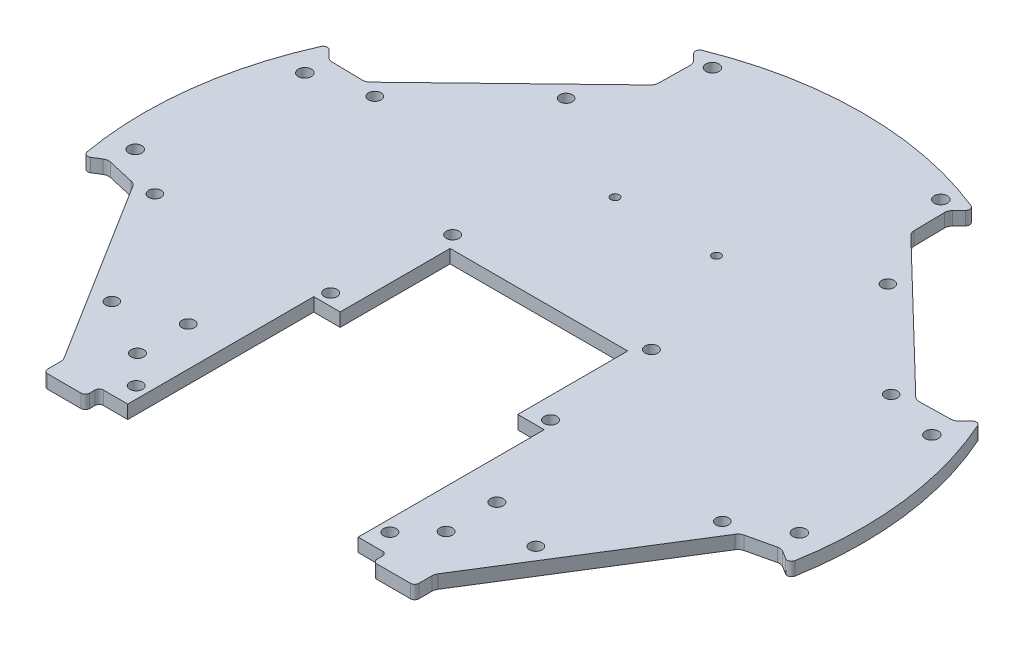
from build123d import *

# Parameters (mm, degrees)
BOSS_EXTRUDE4_DEPTH  = 1.5875
M3_CLEARANCE_HOLE3_D = 3
M3_CLEARANCE_HOLE1_D = 3.1
M3_CLEARANCE_HOLE4_D = 2.95
M3_CLEARANCE_HOLE2_D = 3.1
BOSS_EXTRUDE6_DEPTH  = 3.175
FILLET1_R            = 2
FILLET3_R            = 1
FILLET6_R            = 0.5
SKETCH28_W           = 54.5
SKETCH28_H           = 45
CUT_EXTRUDE4_DEPTH   = 10
CUT_EXTRUDE5_DEPTH   = 10
SKETCH30_W           = 42
SKETCH30_H           = 26
CUT_EXTRUDE6_DEPTH   = 10
SKETCH31_R           = 1.5
CUT_EXTRUDE7_DEPTH   = 10
SKETCH34_R           = 1
CUT_EXTRUDE9_DEPTH   = 10
SKETCH35_R           = 1.5
CUT_EXTRUDE10_DEPTH  = 121.250075508


with BuildPart() as part:
    # Sketch1 → Boss-Extrude4 (new, symmetric)
    with BuildSketch(Plane(origin=(0, 0, 0), x_dir=(1, 0, 0), z_dir=(0, 1, 0))):
        with BuildLine():
            Line((-62.799553621, 32.496136604), (-73.969425011, 32.691107434))
            Line((-73.969425011, 32.691107434), (-77.053684287, 35.88495141))
            ThreePointArc((-77.053684287, 35.88495141), (-84.36642289, 10.358894189), (-83.446216027, -16.178041625))
            Line((-83.446216027, -16.178041625), (-79.680911643, -13.825218315))
            Line((-79.680911643, -13.825218315), (-69.484649137, -16.179210996))
            Line((-69.484649137, -16.179210996), (-43.894490772, -57.132025032))
            Line((-43.894490772, -57.132025032), (-43.894490772, -64.826600275))
            Line((-43.894490772, -64.826600275), (-43.094490772, -64.826600275))
            Line((-43.094490772, -64.826600275), (-34, -64.826600275))
            Line((-34, -64.826600275), (-34, -62.55))
            Line((-34, -62.55), (-34, -61.55))
            Line((-34, -61.55), (-20, -61.55))
            Line((-20, -61.55), (-19.859459165, -62.55))
            Line((-19.859459165, -62.55), (19.859459165, -62.55))
            Line((19.859459165, -62.55), (20, -61.55))
            Line((20, -61.55), (34, -61.55))
            Line((34, -61.55), (34, -62.55))
            Line((34, -62.55), (34, -64.826600275))
            Line((34, -64.826600275), (43.094490772, -64.826600275))
            Line((43.094490772, -64.826600275), (43.894490772, -64.826600275))
            Line((43.894490772, -64.826600275), (43.894490772, -57.132025032))
            Line((43.894490772, -57.132025032), (69.484649137, -16.179210996))
            Line((69.484649137, -16.179210996), (79.680911643, -13.825218315))
            Line((79.680911643, -13.825218315), (83.446216027, -16.178041625))
            ThreePointArc((83.446216027, -16.178041625), (84.610662337, -8.126242604), (85, 0))
            ThreePointArc((85, 0), (82.98964744, 18.377116688), (77.053684287, 35.88495141))
            Line((77.053684287, 35.88495141), (73.969425011, 32.691107434))
            Line((73.969425011, 32.691107434), (62.799553621, 32.496136604))
            Line((62.799553621, 32.496136604), (30.284668021, 63.895396642))
            Line((30.284668021, 63.895396642), (30.089697191, 75.065268032))
            Line((30.089697191, 75.065268032), (33.173956467, 78.259112008))
            ThreePointArc((33.173956467, 78.259112008), (0, 85), (-33.173956467, 78.259112008))
            Line((-33.173956467, 78.259112008), (-30.089697191, 75.065268032))
            Line((-30.089697191, 75.065268032), (-30.284668021, 63.895396642))
            Line((-30.284668021, 63.895396642), (-62.799553621, 32.496136604))
        make_face()
    extrude(amount=BOSS_EXTRUDE4_DEPTH, both=True)

    # M3 Clearance Hole3 (through all)
    with Locations(Plane(origin=(0, -1.5875, 0), x_dir=(-1, 0, 0), z_dir=(0, -1, 0))):
        with Locations((36.5, -50), (36.5, -38), (-36.5, -50), (-36.5, -38)):
            Hole(M3_CLEARANCE_HOLE3_D / 2)

    # M3 Clearance Hole1 (through all)
    with Locations(Plane(origin=(0, 1.5875, 0), x_dir=(1, 0, 0), z_dir=(0, 1, 0))):
        with Locations((-78.542321426, -8.49139241), (78.542321426, -8.49139241), (74.155025063, 27.240269049), (-74.155025063, 27.240269049)):
            Hole(M3_CLEARANCE_HOLE1_D / 2)

    # M3 Clearance Hole4 (through all)
    with Locations(Plane(origin=(0, -1.5875, 0), x_dir=(-1, 0, 0), z_dir=(0, -1, 0))):
        with Locations((-67.099301622, -15.278865202), (-50.141885166, -42.416404279), (-61.062544382, 30.698137949), (-38.043670771, 52.927205804), (50.141885166, -42.416404279), (67.099301622, -15.278865202), (38.043670771, 52.927205804), (61.062544382, 30.698137949)):
            Hole(M3_CLEARANCE_HOLE4_D / 2)

    # M3 Clearance Hole2 (through all)
    with Locations(Plane(origin=(0, 1.5875, 0), x_dir=(1, 0, 0), z_dir=(0, 1, 0))):
        with Locations((27, 76.497766718), (-27, 76.497766718)):
            Hole(M3_CLEARANCE_HOLE2_D / 2)

    # Sketch22 → Boss-Extrude6 (add)
    with BuildSketch(Plane(origin=(0, 1.5875, 0), x_dir=(1, 0, 0), z_dir=(0, 1, 0))):
        Polygon((65.061950694, 32.535626892), (30.245177733, 66.157793715), (30.284668021, 63.895396642), (62.799553621, 32.496136604), align=None)
        Polygon((-30.284668021, 63.895396642), (-30.245177733, 66.157793715), (-65.061950694, 32.535626892), (-62.799553621, 32.496136604), align=None)
        Polygon((43.894490772, -60.151352895), (71.689396914, -15.670204865), (69.484649137, -16.179210996), (43.894490772, -57.132025032), align=None)
        Polygon((-69.484649137, -16.179210996), (-71.689396914, -15.670204865), (-43.894490772, -60.151352895), (-43.894490772, -57.132025032), align=None)
    extrude(amount=-BOSS_EXTRUDE6_DEPTH)

    # Fillet1
    fillet1_edges = [part.edges().sort_by_distance(p)[0] for p in [
        (-30.245177733, 0.79375, -66.157793715),
        (-65.061950694, 0.79375, -32.535626892),
        (-71.689396914, 0.79375, 15.670204865),
        (-43.894490772, 0.79375, 60.151352895),
        (43.894490772, -0.79375, 60.151352895),
        (71.689396914, -0.79375, 15.670204865),
        (65.061950694, 0.79375, -32.535626892),
        (30.245177733, -0.79375, -66.157793715),
        (30.089697191, -0.79375, -75.065268032),
        (73.969425011, -0.79375, -32.691107434),
        (79.680911643, -0.79375, 13.825218315),
        (-79.680911643, -0.79375, 13.825218315),
        (-73.969425011, -0.79375, -32.691107434),
        (-30.089697191, -0.79375, -75.065268032),
    ]]
    fillet(fillet1_edges, radius=FILLET1_R)

    # Fillet3
    fillet3_edges = [part.edges().sort_by_distance(p)[0] for p in [
        (33.173956467, -0.79375, -78.259112008),
        (77.053684287, 0.79375, -35.88495141),
        (83.446216027, -0.79375, 16.178041625),
        (43.894490772, -0.79375, 64.826600275),
        (34, 0.79375, 64.826600275),
        (34, -0.79375, 61.55),
        (-34, -0.79375, 61.55),
        (-34, 0.79375, 64.826600275),
        (-43.894490772, -0.79375, 64.826600275),
        (-83.446216027, -0.79375, 16.178041625),
        (-77.053684287, -0.79375, -35.88495141),
        (-33.173956467, -0.79375, -78.259112008),
    ]]
    fillet(fillet3_edges, radius=FILLET3_R - 0.0001)  # a hair under: the kernel refuses the full size

    # Fillet6
    fillet6_edges = [part.edges().sort_by_distance(p)[0] for p in [
        (20, -0.79375, 61.55),
        (19.859459165, -0.79375, 62.55),
        (-19.859459165, 0.79375, 62.55),
        (-20, 0.79375, 61.55),
    ]]
    fillet(fillet6_edges, radius=FILLET6_R)

    # Sketch28 → Cut-Extrude4 (cut)
    with BuildSketch(Plane(origin=(0, 1.5875, 0), x_dir=(1, 0, 0), z_dir=(0, 1, 0))):
        with Locations((0, -40.05)):
            Rectangle(SKETCH28_W, SKETCH28_H)
    extrude(amount=-CUT_EXTRUDE4_DEPTH, mode=Mode.SUBTRACT)

    # Sketch29 → Cut-Extrude5 (cut)
    with BuildSketch(Plane(origin=(0, 1.5875, 0), x_dir=(1, 0, 0), z_dir=(0, 1, 0))):
        with BuildLine():
            ThreePointArc((-31.5, -56.8), (-30, -58.3), (-28.5, -56.8))
            Line((-28.5, -56.8), (-30, -56.8))
            Line((-30, -56.8), (-31.5, -56.8))
        make_face()
        with BuildLine():
            Line((-30, -56.8), (-28.5, -56.8))
            ThreePointArc((-28.5, -56.8), (-30, -55.3), (-31.5, -56.8))
            Line((-31.5, -56.8), (-30, -56.8))
        make_face()
        with BuildLine():
            ThreePointArc((28.5, -56.8), (30, -58.3), (31.5, -56.8))
            ThreePointArc((31.5, -56.8), (30, -55.3), (28.5, -56.8))
        make_face()
    extrude(amount=-CUT_EXTRUDE5_DEPTH, mode=Mode.SUBTRACT)

    # Sketch30 → Cut-Extrude6 (cut)
    with BuildSketch(Plane(origin=(0, 1.5875, 0), x_dir=(1, 0, 0), z_dir=(0, 1, 0))):
        with Locations((0, -4.55)):
            Rectangle(SKETCH30_W, SKETCH30_H)
    extrude(amount=-CUT_EXTRUDE6_DEPTH, mode=Mode.SUBTRACT)

    # Sketch31 → Cut-Extrude7 (cut)
    with BuildSketch(Plane(origin=(0, 1.5875, 0), x_dir=(1, 0, 0), z_dir=(0, 1, 0))):
        with Locations(Location((-26, -14.8, 0), (0, 0, 270))):
            Circle(SKETCH31_R)
        with Locations(Location((26, -14.8, 0), (0, 0, 270))):
            Circle(SKETCH31_R)
    extrude(amount=-CUT_EXTRUDE7_DEPTH, mode=Mode.SUBTRACT)

    # Sketch34 → Cut-Extrude9 (cut)
    with BuildSketch(Plane(origin=(0, 1.5875, 0), x_dir=(1, 0, 0), z_dir=(0, 1, 0))):
        with Locations(Location((-12, 38.45, 0), (0, 0, 270))):
            Circle(SKETCH34_R)
        with Locations(Location((12, 38.45, 0), (0, 0, 270))):
            Circle(SKETCH34_R)
    extrude(amount=-CUT_EXTRUDE9_DEPTH, mode=Mode.SUBTRACT)

    # Sketch35 → Cut-Extrude10 (cut, through all)
    with BuildSketch(Plane(origin=(0, 1.5875, 0), x_dir=(1, 0, 0), z_dir=(0, 1, 0))):
        with Locations(Location((-23.5, 11.55, 0), (0, 0, 270))):
            Circle(SKETCH35_R)
        with Locations(Location((23.5, 11.55, 0), (0, 0, 270))):
            Circle(SKETCH35_R)
    extrude(amount=-CUT_EXTRUDE10_DEPTH, mode=Mode.SUBTRACT)


solid = part.part
